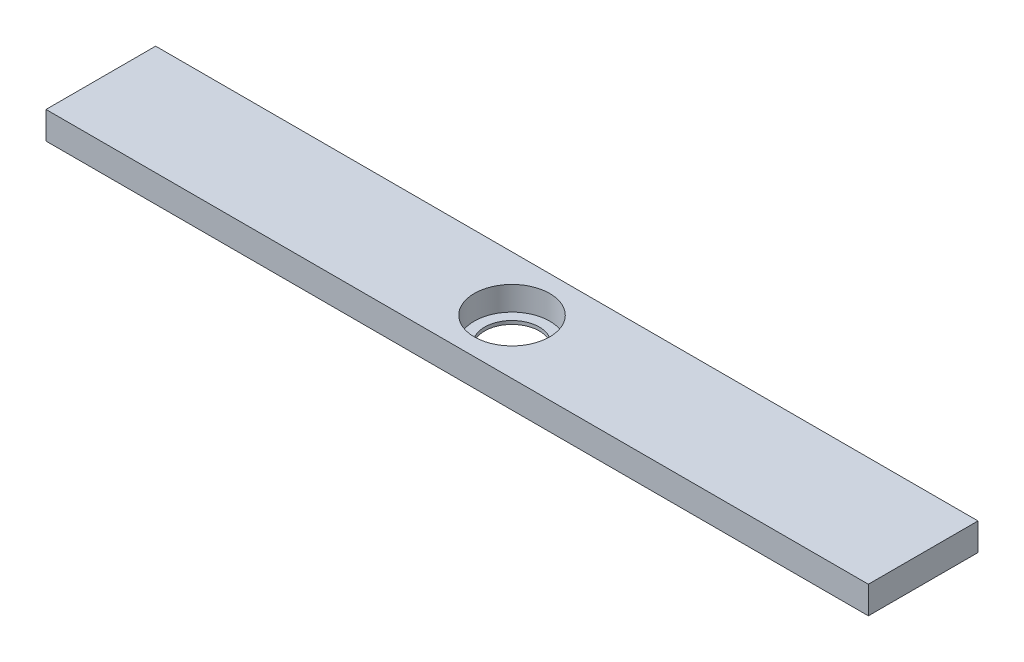
from build123d import *

# Parameters (mm, degrees)
SKETCH1_W           = 381
SKETCH1_H           = 50.8
BOSS_EXTRUDE1_DEPTH = 12.7
SKETCH2_R           = 17.4625
CUT_EXTRUDE1_DEPTH  = 11.1125
SKETCH3_R           = 12.7
CUT_EXTRUDE2_DEPTH  = 193.506876906


with BuildPart() as part:
    # Sketch1 → Boss-Extrude1 (new body)
    with BuildSketch(Plane(origin=(0, 0, 0), x_dir=(1, 0, 0), z_dir=(0, 1, 0))):
        Rectangle(SKETCH1_W, SKETCH1_H)
    extrude(amount=BOSS_EXTRUDE1_DEPTH)

    # Sketch2 → Cut-Extrude1 (cut)
    with BuildSketch(Plane(origin=(0, 12.7, 0), x_dir=(1, 0, 0), z_dir=(0, 1, 0))):
        Circle(SKETCH2_R)
    extrude(amount=-CUT_EXTRUDE1_DEPTH, mode=Mode.SUBTRACT)

    # Sketch3 → Cut-Extrude2 (cut, through all)
    with BuildSketch(Plane(origin=(0, 1.5875, 0), x_dir=(1, 0, 0), z_dir=(0, 1, 0))):
        Circle(SKETCH3_R)
    extrude(amount=-CUT_EXTRUDE2_DEPTH, mode=Mode.SUBTRACT)


solid = part.part
